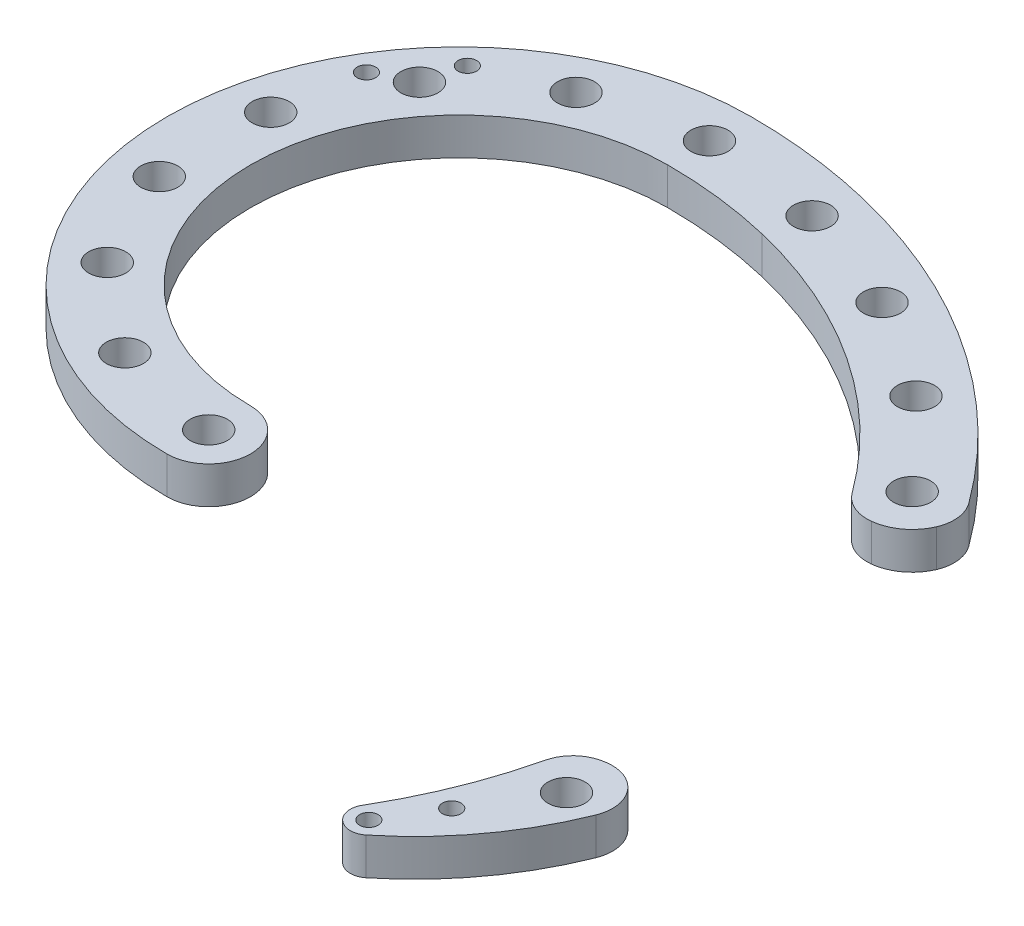
from build123d import *

# Parameters (mm, degrees)
EXTRUDE_2_OUTLINE_R   = 2
EXTRUDE_2_OUTLINE_R_2 = 1
EXTRUDE_2_DEPTH       = 4
CUT_EXTRUDE_START     = -10
CUT_EXTRUDE_3_DEPTH   = 10
FILLET_1_R            = 4
FILLET_2_R            = 4


with BuildPart() as part:
    # 凸台-拉伸2: read off the stored shape, not the designer's step
    # 凸台-拉伸2 outline → 凸台-拉伸2 (new body)
    with BuildSketch(Plane(origin=(0, 0, 0), x_dir=(1, 0, 0), z_dir=(0, 1, 0))):
        with BuildLine():
            ThreePointArc((0, -31.5), (4.5, -27), (0, -22.5))
            ThreePointArc((0, -22.5), (-22.5, 3.7e-08), (7.4e-08, 22.5))
            ThreePointArc((7.4e-08, 22.5), (5.787375943, 22.160515492), (11.49536899, 21.146718391))
            ThreePointArc((11.49536899, 21.146718391), (46.318634446, -8.282336699), (43.339524989, -53.777984924))
            ThreePointArc((43.339524989, -53.777984924), (43.755673323, -56.307687994), (46.319034695, -56.349587119))
            ThreePointArc((46.319034695, -56.349587119), (55.582439452, -44.874948294), (59.297272191, -30.603367387))
            ThreePointArc((59.297272191, -30.603367387), (47.302958929, 7.854702908), (13.58555366, 29.900639116))
            ThreePointArc((13.58555366, 29.900639116), (6.839686095, 31.09878393), (0, 31.5))
            ThreePointArc((0, 31.5), (-31.5, 0), (0, -31.5))
        make_face()
        with Locations((-11.714860956, -24.326159433)):
            Circle(EXTRUDE_2_OUTLINE_R, mode=Mode.SUBTRACT)
        with Locations((-21.109450027, -16.83422465)):
            Circle(EXTRUDE_2_OUTLINE_R, mode=Mode.SUBTRACT)
        with Locations((0, -27)):
            Circle(EXTRUDE_2_OUTLINE_R, mode=Mode.SUBTRACT)
        with Locations((45.062444179, -54.793637159)):
            Circle(EXTRUDE_2_OUTLINE_R_2, mode=Mode.SUBTRACT)
        with Locations((48.449771136, -49.246023611)):
            Circle(EXTRUDE_2_OUTLINE_R_2, mode=Mode.SUBTRACT)
        with Locations((53.170264587, -41.583325549)):
            Circle(EXTRUDE_2_OUTLINE_R, mode=Mode.SUBTRACT)
        with Locations((54.835170241, -29.39015795)):
            Circle(EXTRUDE_2_OUTLINE_R, mode=Mode.SUBTRACT)
        with Locations((53.752708813, -17.131547744)):
            Circle(EXTRUDE_2_OUTLINE_R, mode=Mode.SUBTRACT)
        with Locations((-26.323053629, -6.008065217)):
            Circle(EXTRUDE_2_OUTLINE_R, mode=Mode.SUBTRACT)
        with Locations((-26.323053629, 6.008065217)):
            Circle(EXTRUDE_2_OUTLINE_R, mode=Mode.SUBTRACT)
        with Locations((-24.884124338, 14.892291829)):
            Circle(EXTRUDE_2_OUTLINE_R_2, mode=Mode.SUBTRACT)
        with Locations((-21.109450027, 16.83422465)):
            Circle(EXTRUDE_2_OUTLINE_R, mode=Mode.SUBTRACT)
        with Locations((-20.056149569, 20.946380701)):
            Circle(EXTRUDE_2_OUTLINE_R_2, mode=Mode.SUBTRACT)
        with Locations((-11.714860956, 24.326159433)):
            Circle(EXTRUDE_2_OUTLINE_R, mode=Mode.SUBTRACT)
        with Locations((0, 27)):
            Circle(EXTRUDE_2_OUTLINE_R, mode=Mode.SUBTRACT)
        with Locations((12.540402592, 25.523692776)):
            Circle(EXTRUDE_2_OUTLINE_R, mode=Mode.SUBTRACT)
        with Locations((49.976860752, -5.418810304)):
            Circle(EXTRUDE_2_OUTLINE_R, mode=Mode.SUBTRACT)
        with Locations((43.695920975, 5.163960715)):
            Circle(EXTRUDE_2_OUTLINE_R, mode=Mode.SUBTRACT)
        with Locations((34.975533575, 14.296103059)):
            Circle(EXTRUDE_2_OUTLINE_R, mode=Mode.SUBTRACT)
        with Locations((24.405378973, 21.203563653)):
            Circle(EXTRUDE_2_OUTLINE_R, mode=Mode.SUBTRACT)
    extrude(amount=EXTRUDE_2_DEPTH)

    # 草图8 → 切除-拉伸3 (cut)
    with BuildSketch(Plane(origin=(0, 4, 0), x_dir=(1, 0, 0), z_dir=(0, 1, 0)).offset(CUT_EXTRUDE_START)):
        with BuildLine():
            ThreePointArc((41.332007484, 0.758065459), (46.632458464, 1.117141276), (48.617709435, 6.044868402))
            ThreePointArc((48.617709435, 6.044868402), (56.970460411, -11.401248213), (59.297272191, -30.603367387))
            ThreePointArc((59.297272191, -30.603367387), (58.809304177, -35.127790179), (57.738444676, -39.550659644))
            ThreePointArc((57.738444676, -39.550659644), (53.817860097, -36.625440914), (49.277451804, -38.445490526))
            ThreePointArc((49.277451804, -38.445490526), (49.342376142, -18.025396576), (41.332007484, 0.758065459))
        make_face()
    extrude(amount=CUT_EXTRUDE_3_DEPTH, mode=Mode.SUBTRACT)


with BuildPart() as cut_extrude_3_piece_1:
    # of the separate pieces the step leaves, piece 1, a body of its own (cut_extrude_3_pieces)
    add(part.part.solids().sort_by_distance((0, 0, -31.5))[0])

    # 圆角1
    fillet_1_edges = [cut_extrude_3_piece_1.edges().sort_by_distance(p)[0] for p in [
        (48.617709435, 2, -6.044868402),
        (41.332007484, 2, -0.758065459),
    ]]
    fillet(fillet_1_edges, radius=FILLET_1_R)


with BuildPart() as cut_extrude_3_piece_2:
    # of the separate pieces the step leaves, piece 2, a body of its own (cut_extrude_3_pieces)
    add(part.part.solids().sort_by_distance((46.319034695, 0, 56.349587119))[0])

    # 圆角2
    # the kernel refuses this fillet: 4 mm, written as the material it takes off along each edge
    with BuildSketch(Plane(origin=(57.738444676, -14.025049708, 39.550659644), x_dir=(-0.3341423886783104, 0, 0.942522606672303), z_dir=(0, 1, 0))) as fillet_2_piece_1:
        with BuildLine():
            CenterArc((2.513497567, -3.997098273), FILLET_2_R, 87.817460056, 113.940415857)
            ThreePointArc((-1.201536862, -5.479838708), (-1.441718234, -2.555528491), (0, 0))
            ThreePointArc((0, 0), (1.332915376, 0.025390115), (2.665830753, 0))
        make_face()
    extrude(amount=32.050099416, mode=Mode.SUBTRACT)
    with BuildSketch(Plane(origin=(49.277451804, -7.489347392, 38.445490526), x_dir=(-0.21731663621924255, 0, 0.9761011625965585), z_dir=(0, 1, 0))) as fillet_2_piece_2:
        with BuildLine():
            CenterArc((1.340704391, 3.999675251), FILLET_2_R, 208.816602823, 60.45329366)
            ThreePointArc((-2.163963783, 2.071644912), (-1.240781155, 0.869946609), (0, 0))
            ThreePointArc((0, 0), (0.644867465, 0.004108735), (1.28973493, 0))
        make_face()
    extrude(amount=18.978694783, mode=Mode.SUBTRACT)


solid = Compound([cut_extrude_3_piece_1.part, cut_extrude_3_piece_2.part])
